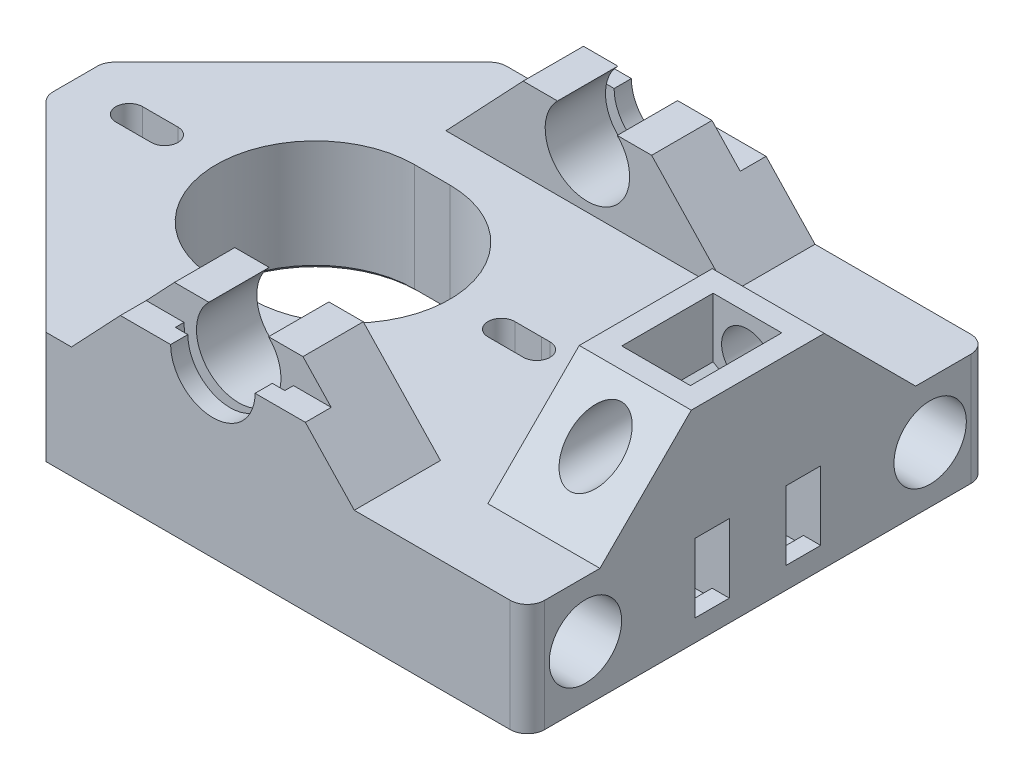
from build123d import *

# Parameters (mm, degrees)
BOSS_EXTRUDE2_DEPTH      = 13
CUT_EXTRUDE6_DEPTH       = 43.108996013
CUT_EXTRUDE7_DEPTH       = 43.108996013
CUT_EXTRUDE8_DEPTH       = 13
SKETCH7_R                = 4.2
CUT_EXTRUDE9_DEPTH       = 30
BOSS_EXTRUDE3_DEPTH      = 10
CUT_EXTRUDE10_DEPTH      = 1
SKETCH13_R               = 4.2
BOSS_EXTRUDE4_DEPTH      = 20.09
SKETCH17_W               = 13
SKETCH17_H               = 15.432451
BOSS_EXTRUDE5_DEPTH      = 10.6
CHAMFER1_SIZE            = 10.6
SKETCH12_R               = 3
CUT_EXTRUDE11_DEPTH      = 77.770333281
CUT_EXTRUDE12_START      = -6.148636
CUT_EXTRUDE12_DEPTH      = 5.3
FILLET2_R                = 2
SKETCH25_W               = 86.308607618
SKETCH25_H               = 69.103285455
CUT_EXTRUDE13_DEPTH      = 0.00151491
CUT_EXTRUDE14_DEPTH      = 58.985456967
CUT_EXTRUDE15_REACH      = 89.237
CUT_EXTRUDE15_END_RADIUS = 11.5
SKETCH27_W               = 4
SKETCH27_H               = 8
SKETCH28_W               = 26.149590075
SKETCH28_H               = 8.463351347
CUT_EXTRUDE16_DEPTH      = 3
FILLET9_R                = 2
SKETCH34_R               = 4.2
BOSS_EXTRUDE7_DEPTH      = 5
CUT_EXTRUDE22_START      = -13
CUT_EXTRUDE22_DEPTH      = 13
CUT_EXTRUDE23_DEPTH      = 58.985456967
CUT_EXTRUDE24_START      = -1
CUT_EXTRUDE24_DEPTH      = 10
CHAMFER2_SIZE            = 0.5


# Read off the part's stored shape, not the designer's step: Cut-Extrude22
with BuildPart() as part:
    # Sketch1 → Boss-Extrude2 (new body)
    with BuildSketch(Plane(origin=(0, 0, 0), x_dir=(1, 0, 0), z_dir=(0, 1, 0))):
        Polygon((-2.969848481, 26.728636329), (-6.906313813, 26.728636329), (-29.828636329, 3.806313813), (-29.828636329, -2.969848481), (-6.069848481, -26.728636329), (-2.969848481, -26.728636329), (2.969848481, -26.728636329), (29.69848481, -26.728636329), (29.69848481, 26.728636329), (2.969848481, 26.728636329), align=None)
    extrude(amount=BOSS_EXTRUDE2_DEPTH)

    # Sketch1<8> → Cut-Extrude6 (cut, through all)
    with BuildSketch(Plane(origin=(0, 0, 0), x_dir=(1, 0, 0), z_dir=(0, 1, 0))):
        with BuildLine():
            Line((-23.14, -1.55), (-20.04, -1.55))
            ThreePointArc((-20.04, -1.55), (-18.49, 0), (-20.04, 1.55))
            Line((-20.04, 1.55), (-23.14, 1.55))
            ThreePointArc((-23.14, 1.55), (-24.69, 0), (-23.14, -1.55))
        make_face()
    extrude(amount=CUT_EXTRUDE6_DEPTH, mode=Mode.SUBTRACT)

    # Sketch1<9> → Cut-Extrude7 (cut, through all)
    with BuildSketch(Plane(origin=(0, 0, 0), x_dir=(1, 0, 0), z_dir=(0, 1, 0))):
        with BuildLine():
            Line((9.28999972, -8.505433812), (9.28999972, 8.505433812))
            ThreePointArc((9.28999972, 8.505433812), (5.69954884, 10.725261974), (1.55, 11.5))
            Line((1.55, 11.5), (-1.55, 11.5))
            ThreePointArc((-1.55, 11.5), (-13.05, 0), (-1.55, -11.5))
            Line((-1.55, -11.5), (1.55, -11.5))
            ThreePointArc((1.55, -11.5), (5.69954884, -10.725261974), (9.28999972, -8.505433812))
        make_face()
        with BuildLine():
            ThreePointArc((9.28999972, -8.505433812), (13.05, 0), (9.28999972, 8.505433812))
            Line((9.28999972, 8.505433812), (9.28999972, -8.505433812))
        make_face()
    extrude(amount=CUT_EXTRUDE7_DEPTH, mode=Mode.SUBTRACT)

    # Sketch1<11> → Cut-Extrude8 (cut)
    with BuildSketch(Plane(origin=(0, 0, 0), x_dir=(1, 0, 0), z_dir=(0, 1, 0))):
        with BuildLine():
            Line((23.139619127, 1.551521906), (20.03999972, 1.550761))
            ThreePointArc((20.03999972, 1.550761), (18.48961936, 0), (20.03999972, -1.550761))
            Line((20.03999972, -1.550761), (23.14, -1.551521999))
            ThreePointArc((23.14, -1.551521999), (24.691521964, 0.000190413), (23.139619127, 1.551521906))
        make_face()
        with BuildLine():
            ThreePointArc((21.589619103, -0.059493857), (21.588478024, -1.2e-08), (21.589619104, 0.059493833))
            ThreePointArc((21.589619104, 0.059493833), (21.590760744, -1.2e-08), (21.589619103, -0.059493857))
        make_face(mode=Mode.SUBTRACT)
    extrude(amount=CUT_EXTRUDE8_DEPTH, mode=Mode.SUBTRACT)


with BuildPart() as cut_extrude8_piece_1:
    # of the separate pieces the step leaves, piece 1, a body of its own (cut_extrude8_pieces)
    add(part.part.solids().sort_by_distance((-6.906313813, 0, -26.728636329))[0])

    # Sketch7 → Cut-Extrude9 (cut)
    with BuildSketch(Plane(origin=(29.69848481, 0, 0), x_dir=(0, 0, -1), z_dir=(1, 0, 0))):
        with Locations((-20, 6.5)):
            Circle(SKETCH7_R)
        with Locations((20, 6.5)):
            Circle(SKETCH7_R)
    extrude(amount=-CUT_EXTRUDE9_DEPTH, mode=Mode.SUBTRACT)

    # Sketch9 → Boss-Extrude3 (add)
    with BuildSketch(Plane.XY.offset(26.728636329)):
        with BuildLine():
            Line((-3.11848537, 13), (29.69848481, 13))
            Line((29.69848481, 13), (20.745211893, 22.464823228))
            Line((20.745211893, 22.464823228), (16.754822948, 22.464823228))
            ThreePointArc((16.754822948, 22.464823228), (13.28999972, 14.1), (9.825176492, 22.464823228))
            Line((9.825176492, 22.464823228), (5.834787547, 22.464823228))
            Line((5.834787547, 22.464823228), (-3.11848537, 13))
        make_face()
    boss_extrude3 = extrude(amount=-BOSS_EXTRUDE3_DEPTH)

    # Sketch10 → Cut-Extrude10 (cut)
    with BuildSketch(Plane.XY.offset(24.728636329)):
        with BuildLine():
            Line((6.93999972, 19), (6.93999972, 29.430631577))
            Line((6.93999972, 29.430631577), (19.63999972, 29.430631577))
            Line((19.63999972, 29.430631577), (19.63999972, 19))
            ThreePointArc((19.63999972, 19), (13.28999972, 12.65), (6.93999972, 19))
        make_face()
    cut_extrude10 = extrude(amount=-CUT_EXTRUDE10_DEPTH, mode=Mode.SUBTRACT)

    # Mirror1: Boss-Extrude3, Cut-Extrude10 across plane
    add(boss_extrude3.mirror(Plane.XY))
    add(cut_extrude10.mirror(Plane.XY), mode=Mode.SUBTRACT)

    # Sketch13 → Boss-Extrude4 (add)
    with BuildSketch(Plane(origin=(29.69848481, 0, 0), x_dir=(0, 0, -1), z_dir=(1, 0, 0))):
        Polygon((-26.728636329, 0), (26.728636329, 0), (26.728636329, 13), (16.728636329, 13), (-16.728636329, 13), (-26.728636329, 13), align=None)
        with Locations((-20, 6.5)):
            Circle(SKETCH13_R, mode=Mode.SUBTRACT)
        with Locations((20, 6.5)):
            Circle(SKETCH13_R, mode=Mode.SUBTRACT)
    extrude(amount=BOSS_EXTRUDE4_DEPTH)

    # Sketch17 → Boss-Extrude5 (add)
    with BuildSketch(Plane(origin=(0, 13, 0), x_dir=(1, 0, 0), z_dir=(0, 1, 0))):
        with Locations((43.28999972, 0)):
            Rectangle(SKETCH17_W, SKETCH17_H)
    extrude(amount=BOSS_EXTRUDE5_DEPTH)

    # Chamfer1
    # the kernel refuses this chamfer: 10.6 mm, written as the material it adds along each edge
    with BuildSketch(Plane(origin=(49.78848481, 13, 7.7162255), x_dir=(0, -0.027495876610586376, 0.9996219169112966), z_dir=(-1, 0, 0)), Plane(origin=(36.78999972, 13, -7.7162255), x_dir=(0, -0.02749587661058638, -0.9996219169112966), z_dir=(1, 0, 0))) as chamfer1_piece_1:
        Polygon((CHAMFER1_SIZE * 0.999621916911, CHAMFER1_SIZE * 0.0274958766106), (-CHAMFER1_SIZE * 0.0274958766106, CHAMFER1_SIZE * 0.999621916911), (0, 0), align=None)
    extrude(amount=12.99848509)

    # Sketch12 → Cut-Extrude11 (cut, through all)
    with BuildSketch(Plane.XY.offset(26.728636329)):
        with Locations(Location((43.28999972, 19, 0), (0, 0, 270))):
            Circle(SKETCH12_R)
    extrude(amount=-CUT_EXTRUDE11_DEPTH, mode=Mode.SUBTRACT)

    # Sketch24 → Cut-Extrude12 (cut)
    with BuildSketch(Plane.XY.offset(6.148636329).offset(CUT_EXTRUDE12_START)):
        Polygon((47.273716577, 23.6), (47.273716577, 21.3), (47.273716577, 16.7), (43.28999972, 14.4), (39.306282862, 16.7), (39.306282862, 21.3), (39.306282862, 23.6), align=None)
    cut_extrude12 = extrude(amount=-CUT_EXTRUDE12_DEPTH, mode=Mode.SUBTRACT)

    # Fillet2
    fillet2_edges = [cut_extrude8_piece_1.edges().sort_by_distance(p)[0] for p in [
        (49.78848481, 6.5, 26.728636329),
        (49.78848481, 6.5, -26.728636329),
    ]]
    fillet(fillet2_edges, radius=FILLET2_R)

    # Sketch25 → Cut-Extrude13 (cut)
    with BuildSketch(Plane(origin=(49.78999972, 0, 0), x_dir=(0, 0, -1), z_dir=(1, 0, 0))):
        with Locations((0, 8.901936044)):
            Rectangle(SKETCH25_W, SKETCH25_H)
    extrude(amount=-CUT_EXTRUDE13_DEPTH, mode=Mode.SUBTRACT)

    # Cut-Extrude15: up to this cylinder (the profile starts outside it)
    cut_extrude15_end = Plane(origin=(1.55, 6.5, 0), z_dir=(0, -1, 0)) * Cylinder(CUT_EXTRUDE15_END_RADIUS, 202.474, mode=Mode.PRIVATE)
    # Sketch27 → Cut-Extrude15 (cut, up to the surface)
    with BuildSketch(Plane(origin=(49.78848481, 0, 0), x_dir=(0, 0, -1), z_dir=(1, 0, 0)), mode=Mode.PRIVATE) as cut_extrude15_sk1:
        with Locations((-5.3, 6.5)):
            Rectangle(SKETCH27_W, SKETCH27_H)
    cut_extrude15_tool1 = extrude(cut_extrude15_sk1.sketch, amount=-CUT_EXTRUDE15_REACH, mode=Mode.PRIVATE) - cut_extrude15_end
    cut_extrude15 = cut_extrude15_tool1.solids().sort_by_distance((49.788485, 6.5, 5.3))[0]
    add(cut_extrude15, mode=Mode.SUBTRACT)

    # Mirror2: Cut-Extrude15 across plane
    add(cut_extrude15.mirror(Plane.XY), mode=Mode.SUBTRACT)

    # Mirror3: Cut-Extrude12 across plane
    add(cut_extrude12.mirror(Plane.XY), mode=Mode.SUBTRACT)

    # Sketch28 → Cut-Extrude16 (cut)
    with BuildSketch(Plane.XY.offset(26.728636329)):
        with Locations((11.690030011, 23.231675673)):
            Rectangle(SKETCH28_W, SKETCH28_H)
    cut_extrude16 = extrude(amount=-CUT_EXTRUDE16_DEPTH, mode=Mode.SUBTRACT)

    # Mirror4: Cut-Extrude16 across plane
    add(cut_extrude16.mirror(Plane.XY), mode=Mode.SUBTRACT)

    # Fillet9
    fillet9_edges = [cut_extrude8_piece_1.edges().sort_by_distance(p)[0] for p in [
        (-6.906313813, 6.5, -26.728636329),
        (-29.828636329, 6.5, -3.806313813),
        (-29.828636329, 6.5, 2.969848481),
    ]]
    fillet(fillet9_edges, radius=FILLET9_R)

    # Sketch34 → Boss-Extrude7 (add)
    with BuildSketch(Plane(origin=(-0.30151519, 0, 0), x_dir=(0, 0, -1), z_dir=(1, 0, 0))):
        with Locations((-20, 6.5)):
            Circle(SKETCH34_R)
        with Locations((20, 6.5)):
            Circle(SKETCH34_R)
    extrude(amount=BOSS_EXTRUDE7_DEPTH)

    # Cut-Extrude22 outline → Cut-Extrude22 (cut)
    with BuildSketch(Plane(origin=(0, 13, 0), x_dir=(1, 0, 0), z_dir=(0, 1, 0)).offset(CUT_EXTRUDE22_START)):
        with BuildLine():
            ThreePointArc((-20.04, 1.55), (-18.49, 0), (-20.04, -1.55))
            Line((-20.04, -1.55), (-19.04, -1.55))
            ThreePointArc((-19.04, -1.55), (-17.49, 0), (-19.04, 1.55))
            Line((-19.04, 1.55), (-20.04, 1.55))
        make_face()
        with BuildLine():
            Line((24.139625451, 1.551521906), (23.14, 1.551521953))
            ThreePointArc((23.14, 1.551521953), (24.691521976, -2.3e-08), (23.14, -1.551521999))
            Line((23.14, -1.551521999), (24.139751204, -1.551521977))
            ThreePointArc((24.139751204, -1.551521977), (25.691147394, 6.2838e-05), (24.139625451, 1.551521906))
        make_face()
    extrude(amount=CUT_EXTRUDE22_DEPTH, mode=Mode.SUBTRACT)

    # Sketch38 → Cut-Extrude23 (cut, through all)
    with BuildSketch(Plane(origin=(0, 13, 0), x_dir=(1, 0, 0), z_dir=(0, 1, 0))):
        with BuildLine():
            ThreePointArc((1.55, 11.5), (13.05, 0), (1.55, -11.5))
            Line((1.55, -11.5), (2.55, -11.5))
            ThreePointArc((2.55, -11.5), (14.05, 0), (2.55, 11.5))
            Line((2.55, 11.5), (1.55, 11.5))
        make_face()
    extrude(amount=-CUT_EXTRUDE23_DEPTH, mode=Mode.SUBTRACT)

    # Sketch39 → Cut-Extrude24 (cut)
    with BuildSketch(Plane(origin=(0, 2.5, 0), x_dir=(1, 0, 0), z_dir=(0, 1, 0)).offset(CUT_EXTRUDE24_START)):
        with BuildLine():
            Line((47.78848481, 7.3), (13.906055653, 7.3))
            ThreePointArc((13.906055653, 7.3), (14.935796911, 5.370478086), (15.640454538, 3.3))
            Line((15.640454538, 3.3), (47.78848481, 3.3))
            Line((47.78848481, 3.3), (47.78848481, 7.3))
        make_face()
        with BuildLine():
            Line((13.906055653, -7.3), (47.78848481, -7.3))
            Line((47.78848481, -7.3), (47.78848481, -3.3))
            Line((47.78848481, -3.3), (15.640454538, -3.3))
            ThreePointArc((15.640454538, -3.3), (14.935796911, -5.370478086), (13.906055653, -7.3))
        make_face()
    extrude(amount=CUT_EXTRUDE24_DEPTH, mode=Mode.SUBTRACT)

    # Chamfer2
    chamfer2_edges = [cut_extrude8_piece_1.edges().sort_by_distance(p)[0] for p in [
        (0.5, 0, 11.5),
        (-13.05, 0, 0),
        (-24.69, 0, 0),
        (-21.09, 0, -1.55),
        (21.58999986, 0, 1.551141499),
        (18.48961936, 0, 0),
        (-17.49, 0, 0),
        (23.139809563, 0, -1.551521941),
        (25.691147394, 0, -6.2838e-05),
        (23.639875602, 0, 1.551521988),
        (23.639812726, 0, -1.55152193),
        (14.05, 0, 0),
        (-21.09, 0, 1.55),
        (0.5, 0, -11.5),
        (21.589809423, 0, -1.551141453),
    ]]
    chamfer(chamfer2_edges, length=CHAMFER2_SIZE)


with BuildPart() as cut_extrude8_piece_2:
    # of the separate pieces the step leaves, piece 2, a body of its own (cut_extrude8_pieces)
    add(part.part.solids().sort_by_distance((21.589619104, 0, -0.059493833))[0])

    # Sketch26 → Cut-Extrude14 (cut, through all)
    with BuildSketch(Plane(origin=(0, 13, 0), x_dir=(1, 0, 0), z_dir=(0, 1, 0))):
        with BuildLine():
            ThreePointArc((21.589619104, 0.059493833), (21.588478024, -1.2e-08), (21.589619103, -0.059493857))
            ThreePointArc((21.589619103, -0.059493857), (21.590760744, -1.2e-08), (21.589619104, 0.059493833))
        make_face()
    extrude(amount=-CUT_EXTRUDE14_DEPTH, mode=Mode.SUBTRACT)


solid = cut_extrude8_piece_1.part
